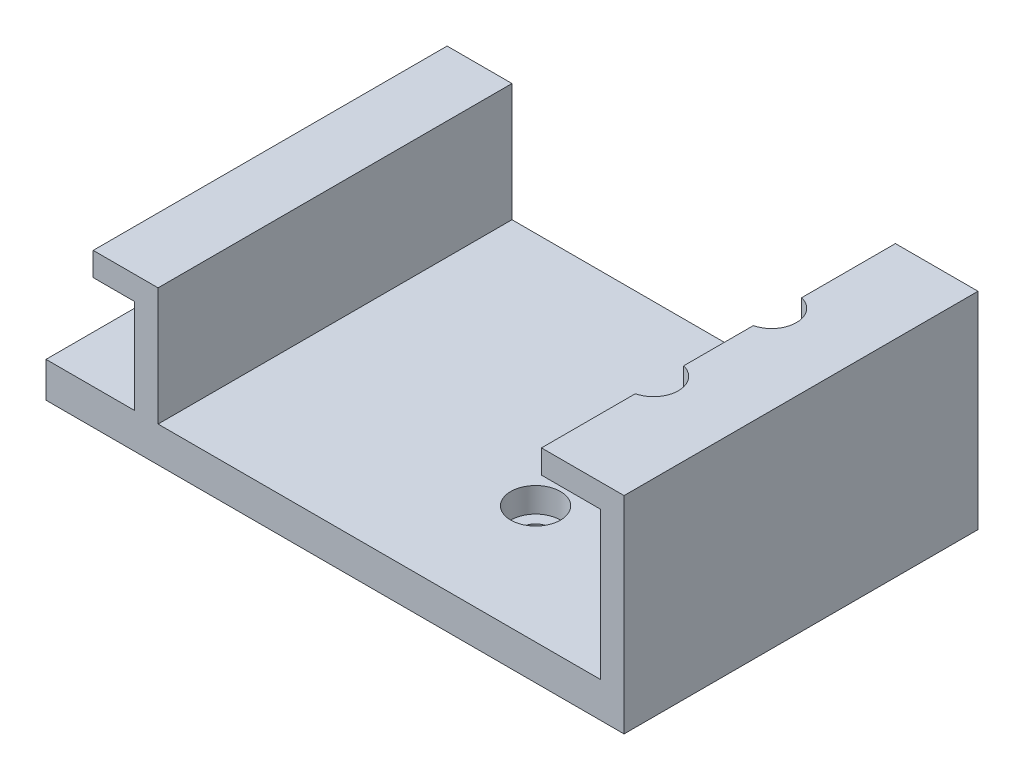
from build123d import *

# Parameters (mm, degrees)
EXTRUDE_BASE_DEPTH              = 30
SKETCH2_R                       = 2.2
CUT_BOLT_HOLES_DEPTH            = 10
CUT_BOLT_HEAD_INSETS_DEPTH      = 40
CUT_BOLT_HEAD_INSETS_DEPTH_BACK = 4.2
SKETCH3_R                       = 4.215
SKETCH4_W                       = 40
SKETCH4_H                       = 3
CUT_TOP_CLEARANCE_SLOT_DEPTH    = 45
FILLET_CLEARANCE_SLOT_PT_1_R    = 3
FILLET_CLEARANCE_SLOT_PT_2_R    = 3


# Some blends are built 0.0001 mm under size
with BuildPart() as part:
    # Sketch1 → Extrude-Base (new, symmetric)
    with BuildSketch(Plane.XY):
        Polygon((-14, 0), (0, 0), (0, -35), (-98, -35), (-98, -29), (-83, -29), (-83, -13), (-90, -13), (-90, -9), (-79, -9), (-79, -29), (-4, -29), (-4, -4), (-14, -4), align=None)
    extrude(amount=EXTRUDE_BASE_DEPTH, both=True)

    # Sketch2 → Cut-Bolt Holes (cut)
    with BuildSketch(Plane(origin=(0, -29, 0), x_dir=(1, 0, 0), z_dir=(0, 1, 0))):
        with Locations(Location((-15, -10, 0), (0, 0, 270))):
            Circle(SKETCH2_R)
        with Locations(Location((-15, 10, 0), (0, 0, 270))):
            Circle(SKETCH2_R)
        with Locations(Location((-35, 10, 0), (0, 0, 270))):
            Circle(SKETCH2_R)
        with Locations(Location((-35, -10, 0), (0, 0, 270))):
            Circle(SKETCH2_R)
    extrude(amount=-CUT_BOLT_HOLES_DEPTH, mode=Mode.SUBTRACT)

    # Sketch3 → Cut-Bolt Head Insets (cut, two sides: drawn at the far end of the back side and taken through both)
    with BuildSketch(Plane(origin=(0, -29, 0), x_dir=(1, 0, 0), z_dir=(0, 1, 0)).offset(-CUT_BOLT_HEAD_INSETS_DEPTH_BACK)):
        with Locations((-35, 10)):
            Circle(SKETCH3_R)
        with Locations((-15, 10)):
            Circle(SKETCH3_R)
        with Locations((-15, -10)):
            Circle(SKETCH3_R)
        with Locations((-35, -10)):
            Circle(SKETCH3_R)
    extrude(amount=CUT_BOLT_HEAD_INSETS_DEPTH + CUT_BOLT_HEAD_INSETS_DEPTH_BACK, mode=Mode.SUBTRACT)

    # Sketch4 → Cut-Top Clearance Slot (cut)
    with BuildSketch(Plane.ZY.offset(98)):
        with Locations((0, -33.5)):
            Rectangle(SKETCH4_W, SKETCH4_H)
    extrude(amount=-CUT_TOP_CLEARANCE_SLOT_DEPTH, mode=Mode.SUBTRACT)

    # Fillet-Clearance Slot Pt 1
    fillet_clearance_slot_pt_1_edges = [part.edges().sort_by_distance(p)[0] for p in [
        (-75.5, -32, 20),
        (-75.5, -32, -20),
    ]]
    fillet(fillet_clearance_slot_pt_1_edges, radius=FILLET_CLEARANCE_SLOT_PT_1_R - 0.0001)  # a hair under: the kernel refuses the full size

    # Fillet-Clearance Slot Pt 2
    # the kernel refuses this fillet: 3 mm, written as the material it takes off along each edge
    with BuildSketch(Plane(origin=(-103.490486718, -35, 20), x_dir=(0, 0, 1), z_dir=(1, 0, 0))) as fillet_clearance_slot_pt_2_piece_1:
        with BuildLine():
            CenterArc((2.196194687, -3), FILLET_CLEARANCE_SLOT_PT_2_R, 90, 60.000551337)
            Line((-0.401895958, -1.500025), (-0.661705022, -1.3500275))
            ThreePointArc((-0.661705022, -1.3500275), (-0.3, -0.0001), (-0.3, 0))
            Line((-0.3, 0), (0, 0.3))
            Line((0, 0.3), (2.196194687, 0.3))
            Line((2.196194687, 0.3), (2.196194687, 0))
        make_face()
    extrude(amount=50.490486718, mode=Mode.SUBTRACT)
    with BuildSketch(Plane(origin=(-103.490486718, -35, -20), x_dir=(0, 0.9659313848535176, 0.25879829936644777), z_dir=(1, 0, 0))) as fillet_clearance_slot_pt_2_piece_2:
        with BuildLine():
            CenterArc((2.329422704, -2.897768274), FILLET_CLEARANCE_SLOT_PT_2_R, 105.000679234, 60.000551337)
            Line((-0.56837145, -2.121373376), (-0.858150866, -2.043733886))
            Line((-0.858150866, -2.043733886), (-0.289779415, 0.07763949))
            Line((-0.289779415, 0.07763949), (0.07763949, 0.289779415))
            ThreePointArc((0.07763949, 0.289779415), (0.077736083, 0.289753536), (1.475282068, 0.289776827))
            Line((1.475282068, 0.289776827), (1.552931216, 0))
        make_face()
    extrude(amount=50.490486718, mode=Mode.SUBTRACT)


solid = part.part
